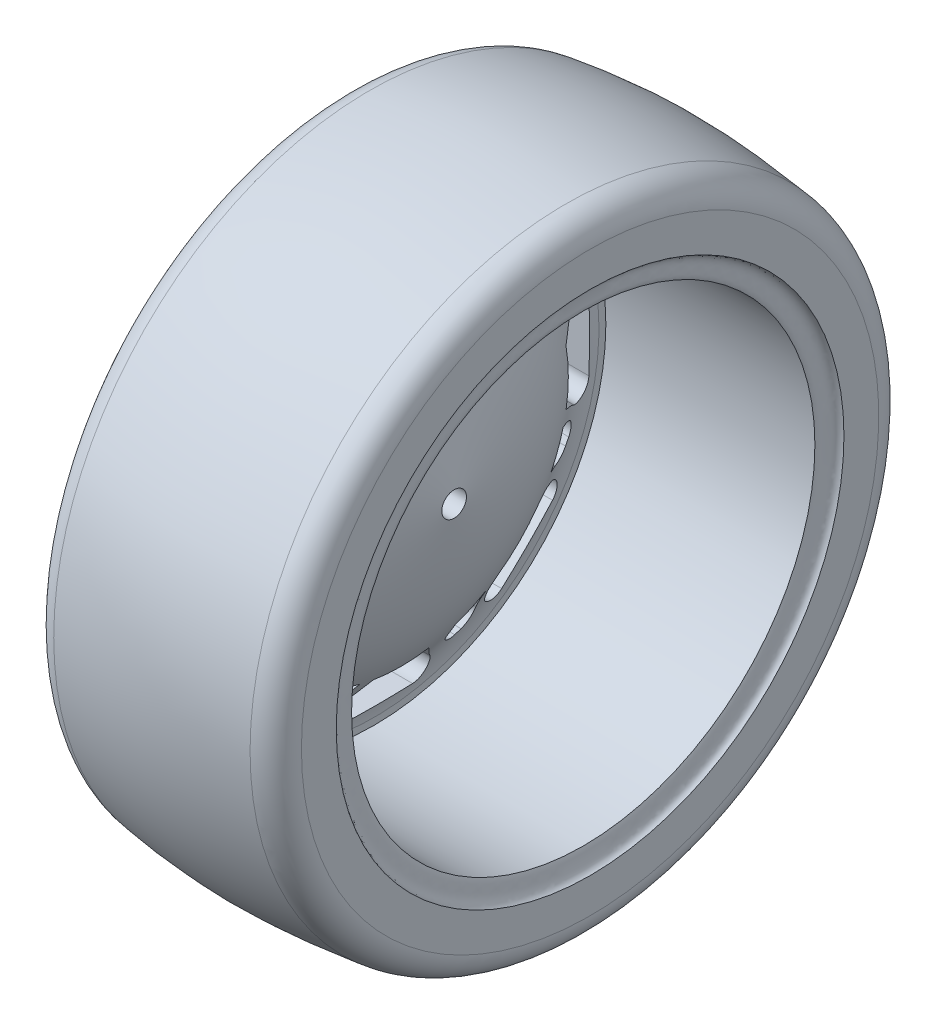
from build123d import *

# Parameters (mm, degrees)
CUT_EXTRUDE1_DEPTH      = 20
CUT_EXTRUDE2_DEPTH      = 20
SCALE1_SCALE            = 0.5
CUT_EXTRUDE3_DEPTH      = 171.774721557
CUT_EXTRUDE3_DEPTH_BACK = 171.774721557
SKETCH4_R               = 2.25


with BuildPart() as part:
    # Sketch1 → Revolve6 (revolve)
    with BuildSketch(Plane.XY):
        with BuildLine():
            Line((-44.392159869, 6.203046167), (-44.392159869, -11.115906995))
            Line((-44.392159869, -11.115906995), (-44.126486924, -18.228453587))
            add(Edge.make_bspline(
                [(-44.126486924, -18.228453587), (-43.527766503, -23.918485856), (-35.324741542, -46.438740467), (-24.771793847, -45.208381497), (-14.286349511, -99.31148473)],
                knots=[0.038572731, 0.038572731, 0.038572731, 0.038572731, 0.225611803, 1, 1, 1, 1], degree=3))
            Line((-14.286349511, -99.31148473), (-4.46902104, -99.31148473))
            Line((-4.46902104, -99.31148473), (-4.46902104, -97.408838762))
            add(Edge.make_bspline(
                [(-34.181390489, -17.182003929), (-34.145144195, -17.526476191), (-34.060402354, -18.224743439), (-33.859028159, -19.531996), (-33.547293052, -21.066001798), (-33.095374824, -22.752606499), (-32.648602678, -24.103148795), (-32.256472773, -25.137590929), (-31.866295249, -26.086978392), (-31.166534189, -27.638949283), (-30.10432898, -29.661884285), (-28.737504086, -31.874425987), (-26.633578711, -34.953377703), (-23.966478501, -38.67976507), (-20.982319883, -43.600514681), (-18.685691271, -47.97242307), (-16.371034524, -53.14585801), (-14.048835137, -59.27061384), (-12.10039884, -65.317226908), (-10.527340232, -70.818558919), (-9.338825805, -75.302188066), (-8.140212777, -80.168863136), (-7.131734563, -84.565969971), (-6.318953548, -88.29976704), (-5.70537231, -91.215904527), (-5.09122557, -94.232756126), (-4.6724623, -96.359116581), (-4.46902104, -97.408838762)],
                knots=[0.038572731, 0.038572731, 0.038572731, 0.038572731, 0.053595032, 0.068617333, 0.098661936, 0.128706538, 0.15875114, 0.176799235, 0.191821536, 0.218840344, 0.278929548, 0.339018753, 0.399107957, 0.519286366, 0.57937557, 0.639464774, 0.699553979, 0.759643183, 0.819732387, 0.849776989, 0.879821591, 0.909866194, 0.939910796, 0.954933097, 0.969955398, 0.984977699, 1, 1, 1, 1], degree=3))
            Line((-34.181390489, -17.182003929), (-34.181390489, -14.672180291))
            Line((-34.181390489, -14.672180291), (42.189870221, -14.672180291))
            add(Edge.make_bspline(
                [(44.697036026, -6.567825526), (41.402075614, -8.083314212), (43.245973894, -12.275178782), (42.189870221, -14.672180291)],
                knots=[0, 0, 0, 0, 1, 1, 1, 1], degree=3))
            Line((44.697036026, -6.567825526), (44.697036026, 6.15918397))
            ThreePointArc((44.697036026, 6.15918397), (42.168855742, 12.805379132), (35.862654001, 16.091018379))
            add(Edge.make_bspline(
                [(-35.864706466, 16.094032291), (-23.937325611, 17.869752516), (0.035883992, 19.829058674), (23.863133821, 17.49930368), (35.862654001, 16.091018379)],
                knots=[0.096298262, 0.096298262, 0.096298262, 0.096298262, 0.50012439, 0.903930042, 0.903930042, 0.903930042, 0.903930042], degree=3))
            ThreePointArc((-35.864706466, 16.094032291), (-41.965978786, 12.732767984), (-44.392159869, 6.203046167))
        make_face()
    revolve(axis=Axis((-14.286349511, -99.31148473, 0), (1, 0, 0)))

    # Sketch2 → Cut-Extrude1 (cut)
    with BuildSketch(Plane.ZY.offset(44.392159869)):
        with BuildLine():
            Line((46.072042754, -35.164796474), (64.689033154, -53.781786874))
            ThreePointArc((64.689033154, -53.781786874), (65.892172661, -58.912618333), (61.831029625, -62.271203357))
            Line((61.831029625, -62.271203357), (46.159790291, -64.414520349))
            ThreePointArc((46.159790291, -64.414520349), (37.59357781, -61.434907241), (34.959121044, -52.756328551))
            Line((34.959121044, -52.756328551), (37.613704602, -37.825117058))
            ThreePointArc((37.613704602, -37.825117058), (41.036356805, -33.930682191), (46.072042754, -35.164796474))
        make_face()
        with BuildLine():
            Line((-16.880521942, -29.237151609), (-8.199635079, -41.672186542))
            ThreePointArc((-8.199635079, -41.672186542), (-0.200110992, -45.946026141), (7.964020576, -41.995703841))
            Line((7.964020576, -41.995703841), (17.5297062, -29.398910259))
            ThreePointArc((17.5297062, -29.398910259), (18.026489734, -24.152370232), (13.547695912, -21.37507262))
            Line((13.547695912, -21.37507262), (-12.780704402, -21.37507262))
            ThreePointArc((-12.780704402, -21.37507262), (-17.214122663, -24.063189723), (-16.880521942, -29.237151609))
        make_face()
        with BuildLine():
            Line((77.936412111, -86.530780328), (77.936412111, -112.859180642))
            ThreePointArc((77.936412111, -112.859180642), (75.159114498, -117.337974464), (69.912574472, -116.84119093))
            Line((69.912574472, -116.84119093), (57.31578089, -107.275505306))
            ThreePointArc((57.31578089, -107.275505306), (53.365458589, -99.111373738), (57.639298188, -91.111849651))
            Line((57.639298188, -91.111849651), (70.074333121, -82.430962789))
            ThreePointArc((70.074333121, -82.430962789), (75.248295007, -82.097362067), (77.936412111, -86.530780328))
        make_face()
        with BuildLine():
            Line((64.146688256, -145.383527484), (45.529697856, -164.000517884))
            ThreePointArc((45.529697856, -164.000517884), (40.398866398, -165.203657391), (37.040281373, -161.142514355))
            Line((37.040281373, -161.142514355), (34.896964382, -145.471275021))
            ThreePointArc((34.896964382, -145.471275021), (37.876577489, -136.90506254), (46.555156179, -134.270605775))
            Line((46.555156179, -134.270605775), (61.486367672, -136.925189332))
            ThreePointArc((61.486367672, -136.925189332), (65.380802539, -140.347841535), (64.146688256, -145.383527484))
        make_face()
        with BuildLine():
            Line((12.780704402, -177.247896841), (-13.547695912, -177.247896841))
            ThreePointArc((-13.547695912, -177.247896841), (-18.026489734, -174.470599228), (-17.5297062, -169.224059202))
            Line((-17.5297062, -169.224059202), (-7.964020576, -156.62726562))
            ThreePointArc((-7.964020576, -156.62726562), (0.200110992, -152.676943319), (8.199635079, -156.950782919))
            Line((8.199635079, -156.950782919), (16.880521942, -169.385817851))
            ThreePointArc((16.880521942, -169.385817851), (17.214122663, -174.559779737), (12.780704402, -177.247896841))
        make_face()
        with BuildLine():
            Line((-46.072042754, -163.458172986), (-64.689033154, -144.841182586))
            ThreePointArc((-64.689033154, -144.841182586), (-65.892172661, -139.710351128), (-61.831029625, -136.351766103))
            Line((-61.831029625, -136.351766103), (-46.159790291, -134.208449112))
            ThreePointArc((-46.159790291, -134.208449112), (-37.59357781, -137.188062219), (-34.959121044, -145.86664091))
            Line((-34.959121044, -145.86664091), (-37.613704602, -160.797852402))
            ThreePointArc((-37.613704602, -160.797852402), (-41.036356805, -164.692287269), (-46.072042754, -163.458172986))
        make_face()
        with BuildLine():
            Line((-77.936412111, -112.092189132), (-77.936412111, -85.763788818))
            ThreePointArc((-77.936412111, -85.763788818), (-75.159114498, -81.284994996), (-69.912574471, -81.78177853))
            Line((-69.912574471, -81.78177853), (-57.31578089, -91.347464155))
            ThreePointArc((-57.31578089, -91.347464155), (-53.365458589, -99.511595722), (-57.639298188, -107.511119809))
            Line((-57.639298188, -107.511119809), (-70.074333121, -116.192006672))
            ThreePointArc((-70.074333121, -116.192006672), (-75.248295007, -116.525607393), (-77.936412111, -112.092189132))
        make_face()
        with BuildLine():
            Line((-64.146688256, -53.239441977), (-45.529697856, -34.622451576))
            ThreePointArc((-45.529697856, -34.622451576), (-40.398866398, -33.419312069), (-37.040281373, -37.480455105))
            Line((-37.040281373, -37.480455105), (-34.896964382, -53.15169444))
            ThreePointArc((-34.896964382, -53.15169444), (-37.876577489, -61.71790692), (-46.555156179, -64.352363686))
            Line((-46.555156179, -64.352363686), (-61.486367672, -61.697780128))
            ThreePointArc((-61.486367672, -61.697780128), (-65.380802539, -58.275127925), (-64.146688256, -53.239441977))
        make_face()
    extrude(amount=-CUT_EXTRUDE1_DEPTH, mode=Mode.SUBTRACT)

    # Sketch3 → Cut-Extrude2 (cut)
    with BuildSketch(Plane.ZY.offset(44.392159869)):
        with BuildLine():
            Line((-27.015610062, -30.137507995), (-29.172487539, -31.459465158))
            ThreePointArc((-29.172487539, -31.459465158), (-31.421613759, -34.555606658), (-30.822683511, -38.33528171))
            Line((-30.822683511, -38.33528171), (-18.966159133, -57.680137275))
            ThreePointArc((-18.966159133, -57.680137275), (-15.870017633, -59.929263495), (-12.090342581, -59.330333248))
            Line((-12.090342581, -59.330333248), (-9.933465104, -58.008376084))
            ThreePointArc((-9.933465104, -58.008376084), (-7.684338884, -54.912234584), (-8.283269132, -51.132559532))
            Line((-8.283269132, -51.132559532), (-20.13979351, -31.787703967))
            ThreePointArc((-20.13979351, -31.787703967), (-23.23593501, -29.538577747), (-27.015610062, -30.137507995))
        make_face()
        with BuildLine():
            Line((28.210488944, -59.386684239), (33.505538706, -37.323976899))
            ThreePointArc((33.505538706, -37.323976899), (32.906608458, -33.544301846), (29.810466959, -31.295175626))
            Line((29.810466959, -31.295175626), (27.350559394, -30.704797811))
            ThreePointArc((27.350559394, -30.704797811), (23.570884342, -31.303728058), (21.321758121, -34.399869558))
            Line((21.321758121, -34.399869558), (16.02670836, -56.462576899))
            ThreePointArc((16.02670836, -56.462576899), (16.625638607, -60.242251951), (19.721780107, -62.491378171))
            Line((19.721780107, -62.491378171), (22.181687672, -63.081755987))
            ThreePointArc((22.181687672, -63.081755987), (25.961362724, -62.482825739), (28.210488944, -59.386684239))
        make_face()
        with BuildLine():
            Line((48.178925198, -91.028215599), (67.523780763, -79.17169122))
            ThreePointArc((67.523780763, -79.17169122), (69.772906983, -76.07554972), (69.173976735, -72.295874668))
            Line((69.173976735, -72.295874668), (67.852019572, -70.138997191))
            ThreePointArc((67.852019572, -70.138997191), (64.755878072, -67.889870971), (60.97620302, -68.488801219))
            Line((60.97620302, -68.488801219), (41.631347455, -80.345325597))
            ThreePointArc((41.631347455, -80.345325597), (39.382221235, -83.441467097), (39.981151483, -87.221142149))
            Line((39.981151483, -87.221142149), (41.303108646, -89.378019626))
            ThreePointArc((41.303108646, -89.378019626), (44.399250146, -91.627145846), (48.178925198, -91.028215599))
        make_face()
        with BuildLine():
            Line((39.924800491, -127.521973674), (61.987507832, -132.817023436))
            ThreePointArc((61.987507832, -132.817023436), (65.767182884, -132.218093188), (68.016309104, -129.121951689))
            Line((68.016309104, -129.121951689), (68.60668692, -126.662044124))
            ThreePointArc((68.60668692, -126.662044124), (68.007756672, -122.882369072), (64.911615172, -120.633242852))
            Line((64.911615172, -120.633242852), (42.848907831, -115.33819309))
            ThreePointArc((42.848907831, -115.33819309), (39.069232779, -115.937123338), (36.820106559, -119.033264837))
            Line((36.820106559, -119.033264837), (36.229728743, -121.493172402))
            ThreePointArc((36.229728743, -121.493172402), (36.828658991, -125.272847454), (39.924800491, -127.521973674))
        make_face()
        with BuildLine():
            Line((8.283269132, -147.490409928), (20.13979351, -166.835265493))
            ThreePointArc((20.13979351, -166.835265493), (23.23593501, -169.084391713), (27.015610062, -168.485461466))
            Line((27.015610062, -168.485461466), (29.172487539, -167.163504302))
            ThreePointArc((29.172487539, -167.163504302), (31.421613759, -164.067362803), (30.822683511, -160.287687751))
            Line((30.822683511, -160.287687751), (18.966159133, -140.942832185))
            ThreePointArc((18.966159133, -140.942832185), (15.870017633, -138.693705965), (12.090342581, -139.292636213))
            Line((12.090342581, -139.292636213), (9.933465104, -140.614593376))
            ThreePointArc((9.933465104, -140.614593376), (7.684338884, -143.710734876), (8.283269132, -147.490409928))
        make_face()
        with BuildLine():
            Line((-28.210488944, -139.236285221), (-33.505538706, -161.298992562))
            ThreePointArc((-33.505538706, -161.298992562), (-32.906608458, -165.078667614), (-29.810466959, -167.327793834))
            Line((-29.810466959, -167.327793834), (-27.350559394, -167.91817165))
            ThreePointArc((-27.350559394, -167.91817165), (-23.570884342, -167.319241402), (-21.321758121, -164.223099902))
            Line((-21.321758121, -164.223099902), (-16.02670836, -142.160392562))
            ThreePointArc((-16.02670836, -142.160392562), (-16.625638607, -138.380717509), (-19.721780107, -136.131591289))
            Line((-19.721780107, -136.131591289), (-22.181687672, -135.541213474))
            ThreePointArc((-22.181687672, -135.541213474), (-25.961362724, -136.140143722), (-28.210488944, -139.236285221))
        make_face()
        with BuildLine():
            Line((-48.178925198, -107.594753862), (-67.523780763, -119.451278241))
            ThreePointArc((-67.523780763, -119.451278241), (-69.772906983, -122.54741974), (-69.173976735, -126.327094792))
            Line((-69.173976735, -126.327094792), (-67.852019572, -128.483972269))
            ThreePointArc((-67.852019572, -128.483972269), (-64.755878072, -130.73309849), (-60.97620302, -130.134168242))
            Line((-60.97620302, -130.134168242), (-41.631347455, -118.277643863))
            ThreePointArc((-41.631347455, -118.277643863), (-39.382221235, -115.181502363), (-39.981151483, -111.401827311))
            Line((-39.981151483, -111.401827311), (-41.303108646, -109.244949834))
            ThreePointArc((-41.303108646, -109.244949834), (-44.399250146, -106.995823614), (-48.178925198, -107.594753862))
        make_face()
        with BuildLine():
            Line((-39.924800491, -71.100995786), (-61.987507832, -65.805946024))
            ThreePointArc((-61.987507832, -65.805946024), (-65.767182884, -66.404876272), (-68.016309104, -69.501017772))
            Line((-68.016309104, -69.501017772), (-68.60668692, -71.960925337))
            ThreePointArc((-68.60668692, -71.960925337), (-68.007756672, -75.740600389), (-64.911615172, -77.989726609))
            Line((-64.911615172, -77.989726609), (-42.848907831, -83.284776371))
            ThreePointArc((-42.848907831, -83.284776371), (-39.069232779, -82.685846123), (-36.820106559, -79.589704623))
            Line((-36.820106559, -79.589704623), (-36.229728743, -77.129797058))
            ThreePointArc((-36.229728743, -77.129797058), (-36.828658991, -73.350122006), (-39.924800491, -71.100995786))
        make_face()
    extrude(amount=-CUT_EXTRUDE2_DEPTH, mode=Mode.SUBTRACT)


with BuildPart() as part_1:
    # Scale1: scaled about (-2.260857386, -99.311491319, -3.763e-06)
    add(part.part.scale(SCALE1_SCALE).moved(Location((-1.130428693, -49.655745659, -1.881e-06))))

    # Sketch4 → Cut-Extrude3 (cut, two sides: drawn at the far end of the back side and taken through both)
    with BuildSketch(Plane(origin=(-3.365020861, 0, 0), x_dir=(0, 0, -1), z_dir=(1, 0, 0)).offset(-CUT_EXTRUDE3_DEPTH_BACK)):
        with Locations((0, -99.311482641)):
            Circle(SKETCH4_R)
    extrude(amount=CUT_EXTRUDE3_DEPTH + CUT_EXTRUDE3_DEPTH_BACK, mode=Mode.SUBTRACT)


solid = part_1.part
